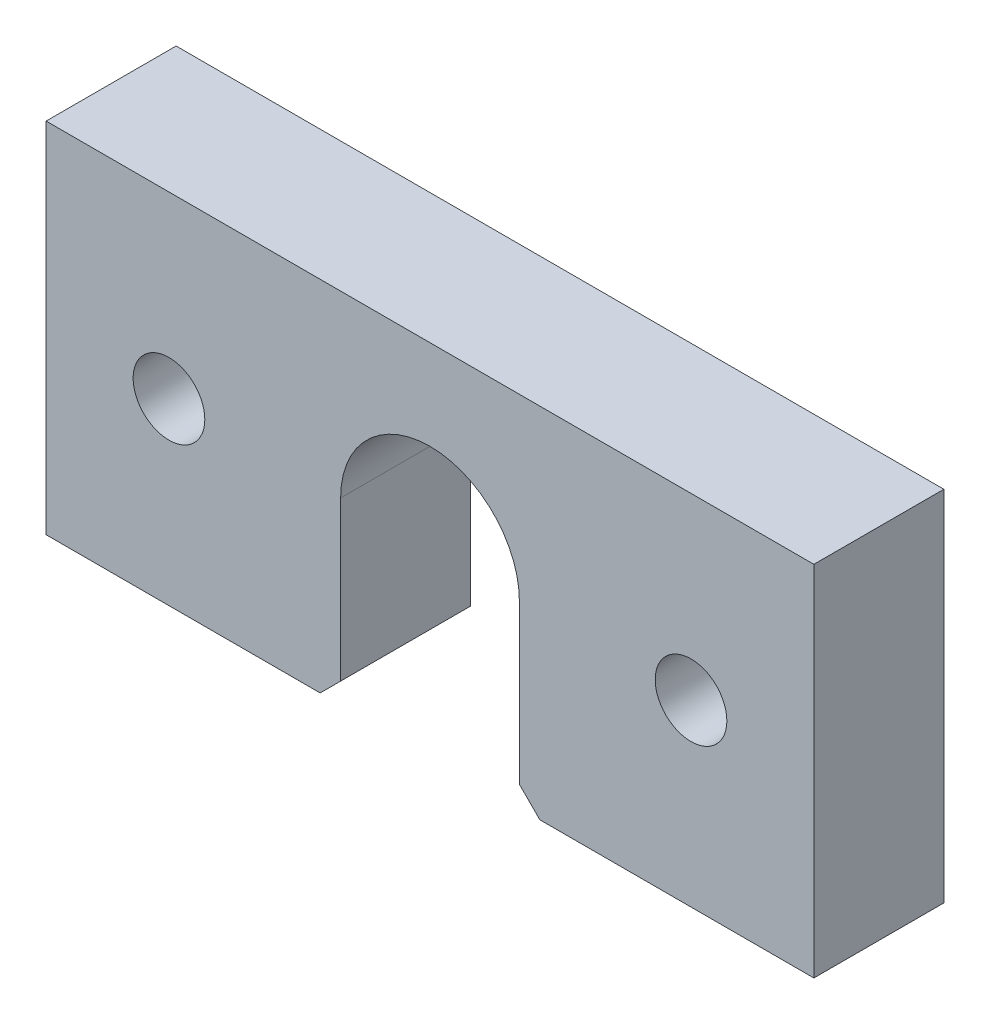
from build123d import *

# Parameters (mm, degrees)
SKETCH1_W             = 75
SKETCH1_H             = 35
BOSS_EXTRUDE1_DEPTH   = 12.7
CUT_EXTRUDE1_REACH    = 45.287
M8X1_0_TAPPED_HOLE1_D = 7
CHAMFER1_SIZE         = 2


with BuildPart() as part:
    # Sketch1 → Boss-Extrude1 (new body)
    with BuildSketch(Plane.XY):
        Rectangle(SKETCH1_W, SKETCH1_H)
    extrude(amount=BOSS_EXTRUDE1_DEPTH)

    # Sketch2 → Cut-Extrude1 (cut, up to next)
    with BuildSketch(Plane(origin=(0, 0, 0), x_dir=(-1, 0, 0), z_dir=(0, 0, -1)), mode=Mode.PRIVATE) as cut_extrude1_sk1:
        with BuildLine():
            Line((-8.73125, 0), (-8.73125, -17.5))
            Line((-8.73125, -17.5), (8.73125, -17.5))
            Line((8.73125, -17.5), (8.73125, 0))
            ThreePointArc((8.73125, 0), (0, 8.73125), (-8.73125, 0))
        make_face()
    cut_extrude1_tool1 = extrude(cut_extrude1_sk1.sketch, amount=-CUT_EXTRUDE1_REACH, mode=Mode.PRIVATE) & part.part
    add(cut_extrude1_tool1.solids().sort_by_distance((0, -5.243288, 0))[0], mode=Mode.SUBTRACT)

    # M8x1.0 Tapped Hole1 (through all)
    with Locations(Plane.XY.offset(12.7)):
        with Locations((-25.5, 0), (25.5, 0)):
            Hole(M8X1_0_TAPPED_HOLE1_D / 2)

    # Chamfer1
    chamfer1_edges = [part.edges().sort_by_distance(p)[0] for p in [
        (8.73125, -17.5, 6.35),
        (-8.73125, -17.5, 6.35),
    ]]
    chamfer(chamfer1_edges, length=CHAMFER1_SIZE)


solid = part.part
